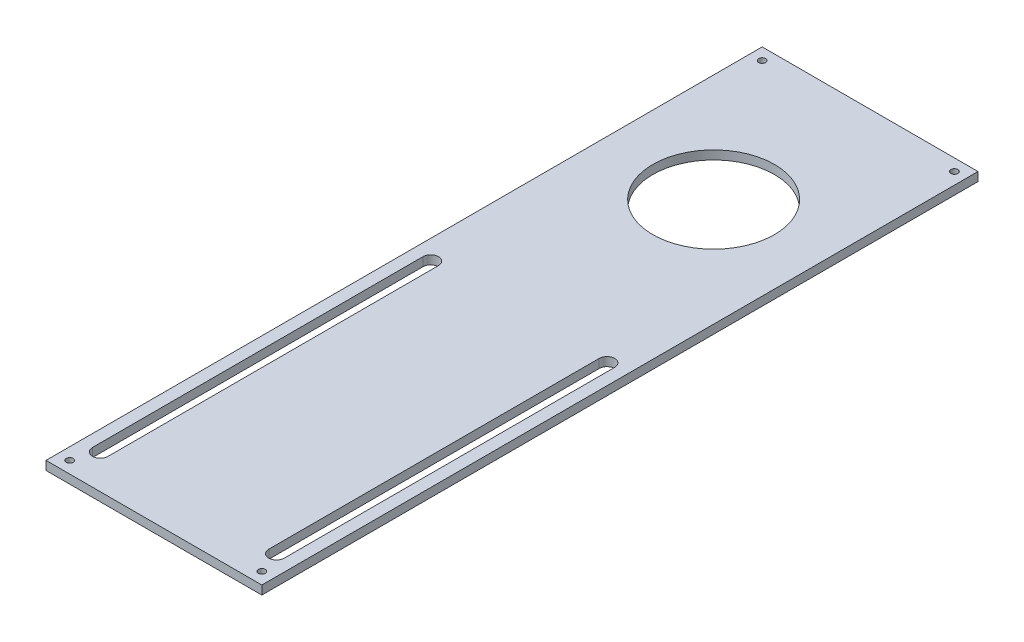
from build123d import *

# Parameters (mm, degrees)
SKETCH2_W           = 78.8444702
SKETCH2_H           = 3.2004
BOSS_EXTRUDE1_DEPTH = 261.62
SKETCH3_R           = 22.225
SKETCH3_R_2         = 1.27
CUT_EXTRUDE1_DEPTH  = 266.388525487


with BuildPart() as part:
    # Sketch2 → Boss-Extrude1 (new body)
    with BuildSketch(Plane.XY):
        with Locations((-5.0277649, -1.6002)):
            Rectangle(SKETCH2_W, SKETCH2_H)
    extrude(amount=BOSS_EXTRUDE1_DEPTH)

    # Sketch3 → Cut-Extrude1 (cut, through all)
    with BuildSketch(Plane.XZ.offset(3.2004)):
        with Locations((-5.0277649, 57.15)):
            Circle(SKETCH3_R)
        with Locations((-40.132, 257.302)):
            Circle(SKETCH3_R_2)
        with Locations((30.0764702, 257.302)):
            Circle(SKETCH3_R_2)
        with Locations((-40.132, 4.318)):
            Circle(SKETCH3_R_2)
        with Locations((30.0764702, 4.318)):
            Circle(SKETCH3_R_2)
        with BuildLine():
            Line((-40.053517537, 128.317412284), (-40.053517537, 249.024041398))
            ThreePointArc((-40.053517537, 249.024041398), (-37.219693042, 251.857865893), (-34.385868547, 249.024041398))
            Line((-34.385868547, 249.024041398), (-34.385868547, 128.317412284))
            ThreePointArc((-34.385868547, 128.317412284), (-37.219693042, 125.483587789), (-40.053517537, 128.317412284))
        make_face()
        with BuildLine():
            Line((24.330338747, 128.317412284), (24.330338747, 249.024041398))
            ThreePointArc((24.330338747, 249.024041398), (27.164163242, 251.857865893), (29.997987737, 249.024041398))
            Line((29.997987737, 249.024041398), (29.997987737, 128.317412284))
            ThreePointArc((29.997987737, 128.317412284), (27.164163242, 125.483587789), (24.330338747, 128.317412284))
        make_face()
    extrude(amount=-CUT_EXTRUDE1_DEPTH, mode=Mode.SUBTRACT)


solid = part.part
